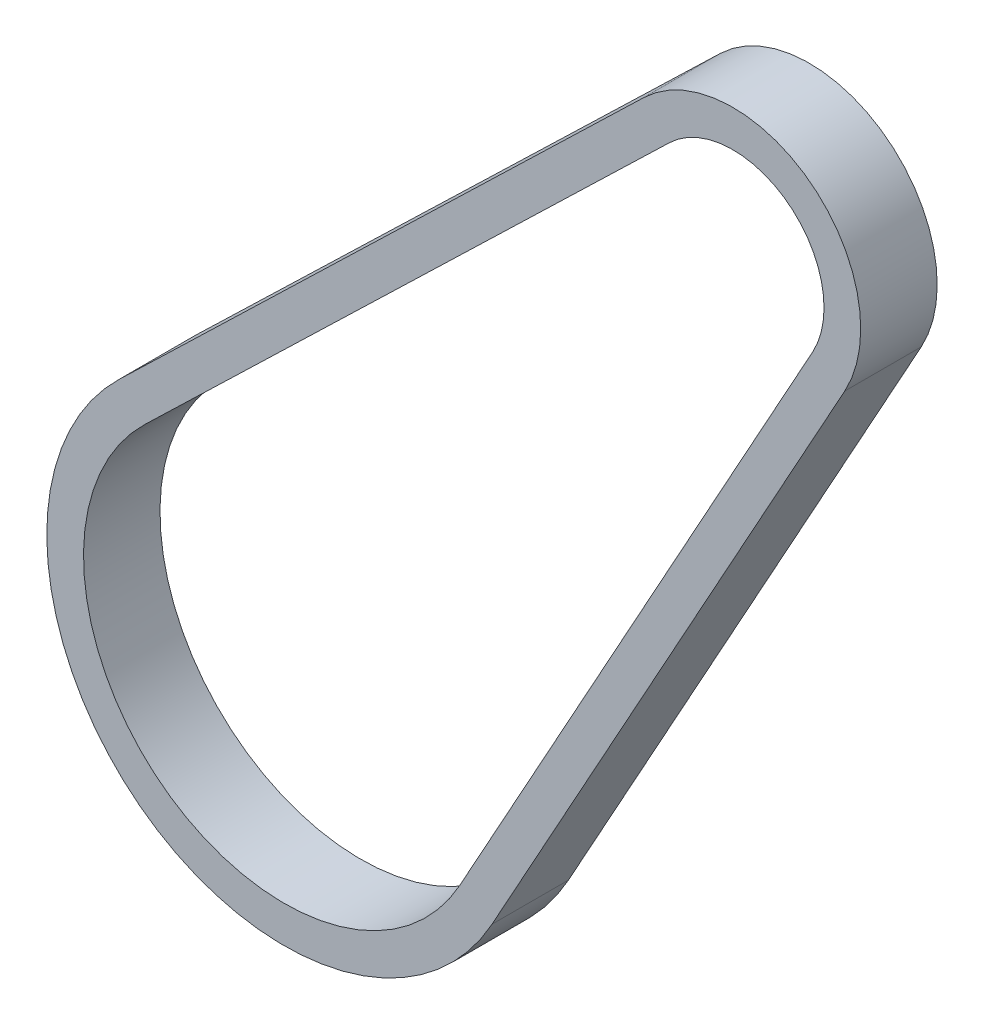
from build123d import *

# Parameters (mm, degrees)
EXTRUDE_THIN1_DEPTH = 5


with BuildPart() as part:
    # Sketch2 → Extrude-Thin1 (new body)
    with BuildSketch(Plane.XY):
        with BuildLine():
            Line((-10.780179977, 11.170523007), (23.530399527, 44.282152781))
            ThreePointArc((23.530399527, 44.282152781), (34.424888555, 44.901221254), (36.655312565, 34.219538535))
            Line((36.655312565, 34.219538535), (13.586131682, -7.510651802))
            ThreePointArc((13.586131682, -7.510651802), (-9.445364699, -12.319819409), (-10.780179977, 11.170523007))
        make_face()
        with BuildLine():
            Line((-9.113565457, 9.443561501), (25.197014047, 42.555191276))
            ThreePointArc((25.197014047, 42.555191276), (32.964636315, 42.996578663), (34.554898251, 35.380684395))
            Line((34.554898251, 35.380684395), (11.485717368, -6.349505942))
            ThreePointArc((11.485717368, -6.349505942), (-7.98511246, -10.415176819), (-9.113565457, 9.443561501))
        make_face(mode=Mode.SUBTRACT)
    extrude(amount=-EXTRUDE_THIN1_DEPTH)


solid = part.part
